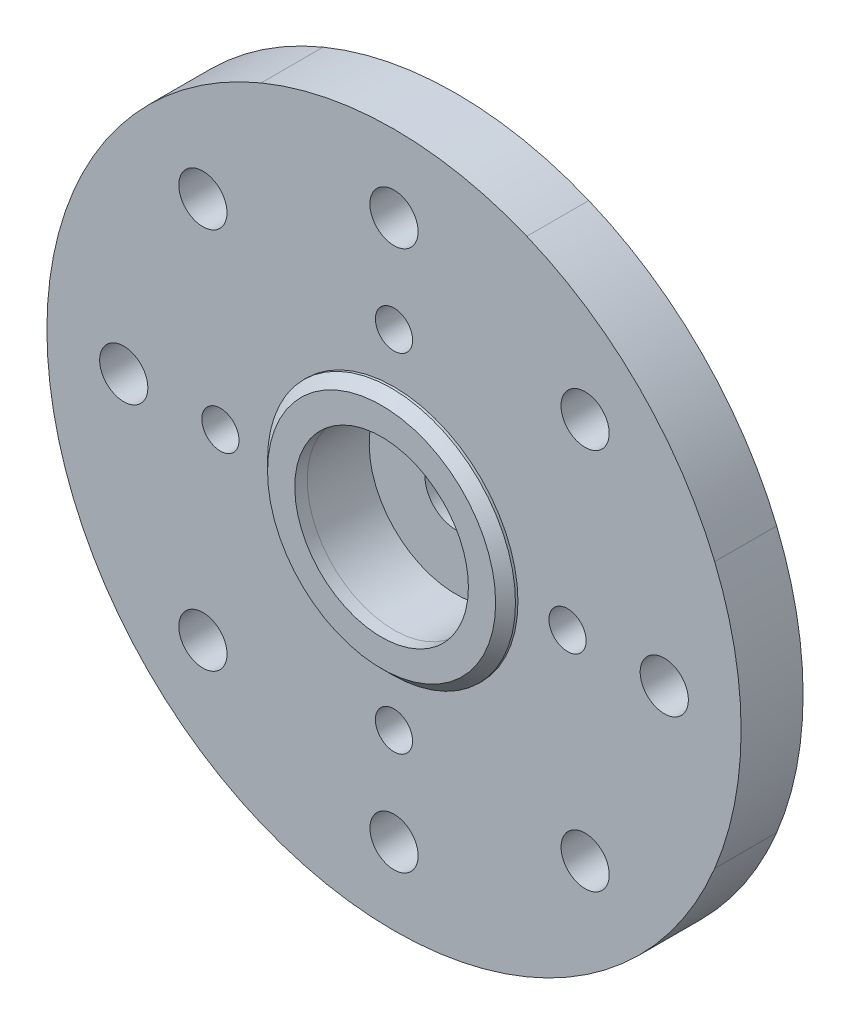
from build123d import *

# Parameters (mm, degrees)
BOSS_EXTRUDE1_OUTLINE_R   = 0.971780714
BOSS_EXTRUDE1_OUTLINE_R_2 = 0.75
BOSS_EXTRUDE1_OUTLINE_R_3 = 3.5
BOSS_EXTRUDE1_DEPTH       = 2.5
SKETCH3_R                 = 5
SKETCH3_R_2               = 1.25
BOSS_EXTRUDE2_DEPTH       = 2
BOSS_EXTRUDE3_START       = 0.5
SKETCH4_R                 = 5
SKETCH4_R_2               = 3.501414214
BOSS_EXTRUDE3_DEPTH       = 0.5
CHAMFER1_SIZE             = 0.4


# Read off the part's stored shape, not the designer's step: Boss-Extrude1
with BuildPart() as part:
    # Boss-Extrude1 outline → Boss-Extrude1 (new body)
    with BuildSketch(Plane.XY):
        with BuildLine():
            ThreePointArc((5.358214498, 12.933459897), (0.001, 13.999), (-5.356214498, 12.933459897))
            ThreePointArc((-5.356214498, 12.933459897), (-9.89778783, 9.89878783), (-12.932459897, 5.357214498))
            ThreePointArc((-12.932459897, 5.357214498), (-13.998, 0), (-12.932459897, -5.357214498))
            ThreePointArc((-12.932459897, -5.357214498), (-9.89778783, -9.89878783), (-5.356214498, -12.933459897))
            ThreePointArc((-5.356214498, -12.933459897), (0.001, -13.999), (5.358214498, -12.933459897))
            ThreePointArc((5.358214498, -12.933459897), (9.89978783, -9.89878783), (12.934459897, -5.357214498))
            ThreePointArc((12.934459897, -5.357214498), (14, 0), (12.934459897, 5.357214498))
            ThreePointArc((12.934459897, 5.357214498), (9.89978783, 9.89878783), (5.358214498, 12.933459897))
        make_face()
        with Locations((-7.705756808, -7.708171022)):
            Circle(BOSS_EXTRUDE1_OUTLINE_R, mode=Mode.SUBTRACT)
        with Locations((0, -7)):
            Circle(BOSS_EXTRUDE1_OUTLINE_R_2, mode=Mode.SUBTRACT)
        with Locations((-10.899, -0.001)):
            Circle(BOSS_EXTRUDE1_OUTLINE_R, mode=Mode.SUBTRACT)
        with Locations((0.002, -10.9)):
            Circle(BOSS_EXTRUDE1_OUTLINE_R, mode=Mode.SUBTRACT)
        with Locations((7.709171022, -7.706756808)):
            Circle(BOSS_EXTRUDE1_OUTLINE_R, mode=Mode.SUBTRACT)
        with Locations((-7, 0)):
            Circle(BOSS_EXTRUDE1_OUTLINE_R_2, mode=Mode.SUBTRACT)
        with Locations((-7.707171022, 7.706756808)):
            Circle(BOSS_EXTRUDE1_OUTLINE_R, mode=Mode.SUBTRACT)
        with Locations((0, 7)):
            Circle(BOSS_EXTRUDE1_OUTLINE_R_2, mode=Mode.SUBTRACT)
        with Locations((0, 10.9)):
            Circle(BOSS_EXTRUDE1_OUTLINE_R, mode=Mode.SUBTRACT)
        with Locations((0.001, 0.001)):
            Circle(BOSS_EXTRUDE1_OUTLINE_R_3, mode=Mode.SUBTRACT)
        with Locations((7, 0)):
            Circle(BOSS_EXTRUDE1_OUTLINE_R_2, mode=Mode.SUBTRACT)
        with Locations((10.901, 0.001)):
            Circle(BOSS_EXTRUDE1_OUTLINE_R, mode=Mode.SUBTRACT)
        with Locations((7.707756808, 7.708171022)):
            Circle(BOSS_EXTRUDE1_OUTLINE_R, mode=Mode.SUBTRACT)
    extrude(amount=BOSS_EXTRUDE1_DEPTH)

    # Sketch3 → Boss-Extrude2 (add)
    with BuildSketch(Plane(origin=(0, 0, 0), x_dir=(-1, 0, 0), z_dir=(0, 0, -1))):
        with Locations(Location((0, 0, 0), (0, 0, 180))):
            Circle(SKETCH3_R)
        Circle(SKETCH3_R_2, mode=Mode.SUBTRACT)
    extrude(amount=BOSS_EXTRUDE2_DEPTH)

    # Sketch4 → Boss-Extrude3 (add)
    with BuildSketch(Plane.XY.offset(2.5).offset(BOSS_EXTRUDE3_START)):
        Circle(SKETCH4_R)
        with Locations(Location((0, 0, 0), (0, 0, 45))):
            Circle(SKETCH4_R_2, mode=Mode.SUBTRACT)
    extrude(amount=-BOSS_EXTRUDE3_DEPTH)

    # Chamfer1
    chamfer1_edges = [part.edges().sort_by_distance(p)[0] for p in [
        (-5, 0, 3),
    ]]
    chamfer(chamfer1_edges, length=CHAMFER1_SIZE)


solid = part.part
